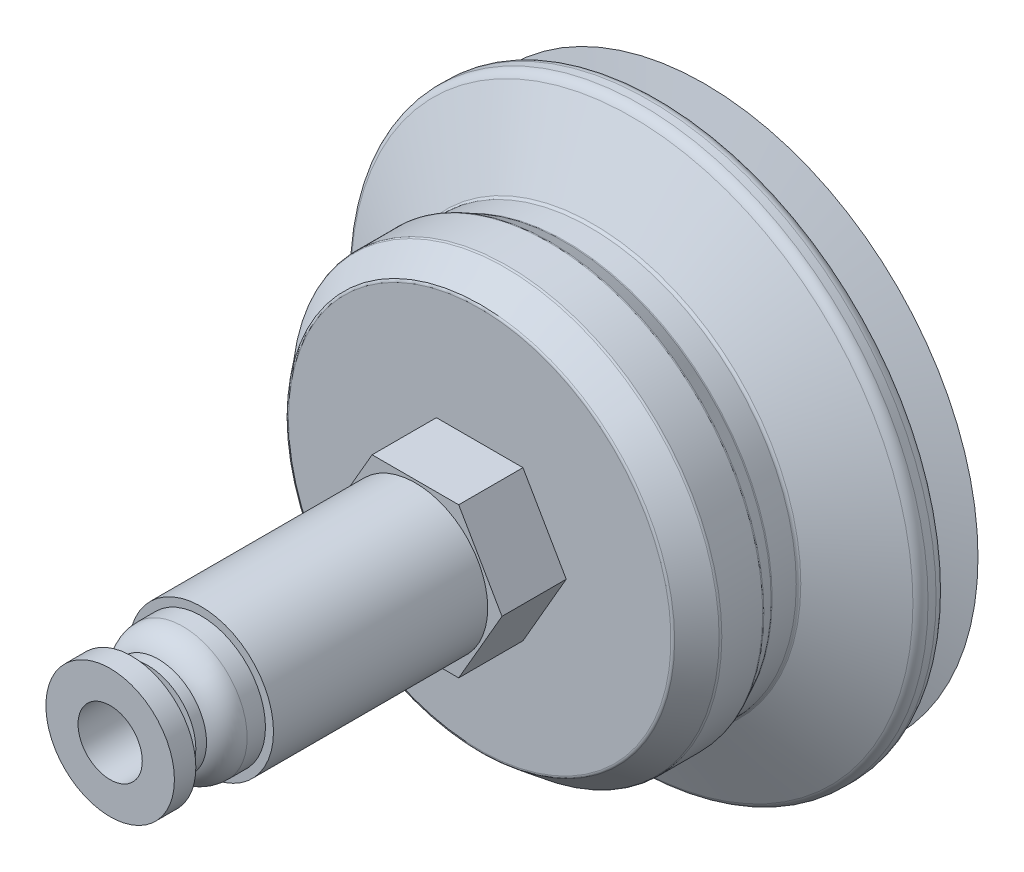
from build123d import *

# Parameters (mm, degrees)
EXTRUDE_1_DEPTH     = 6
SKETCH_2_R          = 6.75
EXTRUDE_2_DEPTH     = 20
SKETCH_3_R          = 6
EXTRUDE_3_DEPTH     = 4
SKETCH_4_R          = 4.5
EXTRUDE_4_DEPTH     = 1
SKETCH_5_R          = 3.5
EXTRUDE_5_DEPTH     = 1.5
SKETCH_6_R          = 6
EXTRUDE_6_DEPTH     = 2
SKETCH_7_R          = 18
EXTRUDE_8_DEPTH     = 2.5
EXTRUDE_8_DRAFT     = -38.7
SKETCH_9_R          = 20.002877676
EXTRUDE_9_DEPTH     = 4
SKETCH_10_R         = 20.002877676
EXTRUDE_10_DEPTH    = 1.5
EXTRUDE_10_TAPER    = 27
SKETCH_11_R         = 19.238589502
EXTRUDE_11_DEPTH    = 2.5
SKETCH_12_R         = 19.238589502
EXTRUDE_12_DEPTH    = 4
EXTRUDE_12_DRAFT    = -62
SKETCH_13_R         = 26.761495364
EXTRUDE_13_DEPTH    = 2
SKETCH_14_R         = 26.761495364
EXTRUDE_14_DEPTH    = 3
EXTRUDE_14_TAPER    = 66.1
SKETCH_15_R         = 19.991610575
EXTRUDE_15_DEPTH    = 1.5
EXTRUDE_15_DRAFT    = -74.83
FILLET_1_R          = 1
FILLET_2_R          = 0.3
FILLET_3_R          = 0.3
SKETCH_16_R         = 1.5
CUT_EXTRUDE_2_DEPTH = 68.175928115
SKETCH_17_R         = 3
CUT_EXTRUDE_3_DEPTH = 8
FILLET_4_R          = 2.5
SKETCH_18_R         = 16.5
CUT_EXTRUDE_4_DEPTH = 6
SKETCH_19_R         = 10
CUT_EXTRUDE_5_DEPTH = 5
EXTRUDE_START       = 2
SKETCH_20_R         = 5.75
SKETCH_20_R_2       = 1.5
EXTRUDE_16_DEPTH    = 2
SKETCH_21_R         = 23.523974929
CUT_EXTRUDE_6_DEPTH = 3
CUT_EXTRUDE_6_DRAFT = -70


with BuildPart() as part:
    # 草图1 → 凸台-拉伸1 (new body)
    with BuildSketch(Plane.XY):
        Polygon((8.082903769, 0), (4.041451884, 7), (-4.041451884, 7), (-8.082903769, 0), (-4.041451884, -7), (4.041451884, -7), align=None)
    extrude(amount=EXTRUDE_1_DEPTH)

    # 草图2 → 凸台-拉伸2 (add)
    with BuildSketch(Plane.XY.offset(6)):
        Circle(SKETCH_2_R)
    extrude(amount=EXTRUDE_2_DEPTH)

    # 草图3 → 凸台-拉伸3 (add)
    with BuildSketch(Plane.XY.offset(26)):
        Circle(SKETCH_3_R)
    extrude(amount=EXTRUDE_3_DEPTH)

    # 草图4 → 凸台-拉伸4 (add)
    with BuildSketch(Plane.XY.offset(30)):
        Circle(SKETCH_4_R)
    extrude(amount=EXTRUDE_4_DEPTH)

    # 草图5 → 凸台-拉伸5 (add)
    with BuildSketch(Plane.XY.offset(31)):
        Circle(SKETCH_5_R)
    extrude(amount=EXTRUDE_5_DEPTH)

    # 草图6 → 凸台-拉伸6 (add)
    with BuildSketch(Plane.XY.offset(32.5)):
        Circle(SKETCH_6_R)
    extrude(amount=EXTRUDE_6_DEPTH)


with BuildPart() as extrude_8_tool:
    # 草图7 → 凸台-拉伸8 (with draft: the straight prism first)
    with BuildSketch(Plane(origin=(0, 0, 0), x_dir=(-1, 0, 0), z_dir=(0, 0, -1))):
        Circle(SKETCH_7_R)
    extrude(amount=EXTRUDE_8_DEPTH)
    # 凸台-拉伸8: the draft: its side faces are tilted about the plane it starts from
    extrude_8_sides = [extrude_8_tool.faces().sort_by_distance(p)[0] for p in [
        (18, 0, -1.25),
    ]]
    draft(extrude_8_sides, Plane(origin=(0, 0, 0), x_dir=(-1, 0, 0), z_dir=(0, 0, -1)), EXTRUDE_8_DRAFT)


with BuildPart() as part_1:
    add(part.part)

    # 凸台-拉伸8: add extrude_8_tool
    add(extrude_8_tool.part)

    # 草图9 → 凸台-拉伸9 (add)
    with BuildSketch(Plane(origin=(0, 0, -2.5), x_dir=(-1, 0, 0), z_dir=(0, 0, -1))):
        Circle(SKETCH_9_R)
    extrude(amount=EXTRUDE_9_DEPTH)

    # 草图10 → 凸台-拉伸10 (add)
    with BuildSketch(Plane(origin=(0, 0, -6.5), x_dir=(-1, 0, 0), z_dir=(0, 0, -1))):
        Circle(SKETCH_10_R)
    extrude(amount=EXTRUDE_10_DEPTH, taper=EXTRUDE_10_TAPER)

    # 草图11 → 凸台-拉伸11 (add)
    with BuildSketch(Plane(origin=(0, 0, -8), x_dir=(-1, 0, 0), z_dir=(0, 0, -1))):
        Circle(SKETCH_11_R)
    extrude(amount=EXTRUDE_11_DEPTH)


with BuildPart() as extrude_12_tool:
    # 草图12 → 凸台-拉伸12 (with draft: the straight prism first)
    with BuildSketch(Plane(origin=(0, 0, -10.5), x_dir=(-1, 0, 0), z_dir=(0, 0, -1))):
        Circle(SKETCH_12_R)
    extrude(amount=EXTRUDE_12_DEPTH)
    # 凸台-拉伸12: the draft: its side faces are tilted about the plane it starts from
    extrude_12_sides = [extrude_12_tool.faces().sort_by_distance(p)[0] for p in [
        (19.238589502, 0, -12.5),
    ]]
    draft(extrude_12_sides, Plane(origin=(0, 0, -10.5), x_dir=(-1, 0, 0), z_dir=(0, 0, -1)), EXTRUDE_12_DRAFT)


with BuildPart() as part_2:
    add(part_1.part)

    # 凸台-拉伸12: add extrude_12_tool
    add(extrude_12_tool.part)

    # 草图13 → 凸台-拉伸13 (add)
    with BuildSketch(Plane(origin=(0, 0, -14.5), x_dir=(-1, 0, 0), z_dir=(0, 0, -1))):
        Circle(SKETCH_13_R)
    extrude(amount=EXTRUDE_13_DEPTH)

    # 草图14 → 凸台-拉伸14 (add)
    with BuildSketch(Plane(origin=(0, 0, -16.5), x_dir=(-1, 0, 0), z_dir=(0, 0, -1))):
        Circle(SKETCH_14_R)
    extrude(amount=EXTRUDE_14_DEPTH, taper=EXTRUDE_14_TAPER)


with BuildPart() as extrude_15_tool:
    # 草图15 → 凸台-拉伸15 (with draft: the straight prism first)
    with BuildSketch(Plane(origin=(0, 0, -19.5), x_dir=(-1, 0, 0), z_dir=(0, 0, -1))):
        Circle(SKETCH_15_R)
    extrude(amount=EXTRUDE_15_DEPTH)
    # 凸台-拉伸15: the draft: its side faces are tilted about the plane it starts from
    extrude_15_sides = [extrude_15_tool.faces().sort_by_distance(p)[0] for p in [
        (19.991610575, 0, -20.25),
    ]]
    draft(extrude_15_sides, Plane(origin=(0, 0, -19.5), x_dir=(-1, 0, 0), z_dir=(0, 0, -1)), EXTRUDE_15_DRAFT)


with BuildPart() as part_3:
    add(part_2.part)

    # 凸台-拉伸15: add extrude_15_tool
    add(extrude_15_tool.part)

    # 圆角1
    fillet_1_edges = [part_3.edges().sort_by_distance(p)[0] for p in [
        (26.761495364, 0, -14.5),
        (26.761495364, 0, -16.5),
    ]]
    fillet(fillet_1_edges, radius=FILLET_1_R)

    # 圆角2
    fillet_2_edges = [part_3.edges().sort_by_distance(p)[0] for p in [
        (19.991610575, 0, -19.5),
    ]]
    fillet(fillet_2_edges, radius=FILLET_2_R)

    # 圆角3
    fillet_3_edges = [part_3.edges().sort_by_distance(p)[0] for p in [
        (18, 0, 0),
        (20.002877676, 0, -2.5),
        (20.002877676, 0, -6.5),
        (19.238589502, 0, -8),
        (19.238589502, 0, -10.5),
    ]]
    fillet(fillet_3_edges, radius=FILLET_3_R)

    # 草图16 → 切除-拉伸2 (cut, through all)
    with BuildSketch(Plane(origin=(0, 0, -21), x_dir=(-1, 0, 0), z_dir=(0, 0, -1))):
        Circle(SKETCH_16_R)
    extrude(amount=-CUT_EXTRUDE_2_DEPTH, mode=Mode.SUBTRACT)

    # 草图17 → 切除-拉伸3 (cut)
    with BuildSketch(Plane.XY.offset(34.5)):
        Circle(SKETCH_17_R)
    extrude(amount=-CUT_EXTRUDE_3_DEPTH, mode=Mode.SUBTRACT)

    # 圆角4
    # the kernel refuses this fillet: 2.5 mm, written as the material it takes off along each edge
    with BuildSketch(Plane(origin=(0, 0, 30), x_dir=(1, 0, 0), z_dir=(0, -1, 0))) as fillet_4_piece_1:
        with BuildLine():
            CenterArc((3.5, -2.291287847), FILLET_4_R, 0, 66.421821522)
            Line((4.5, 0), (4.52, 0.045825757))
            ThreePointArc((4.52, 0.045825757), (5.25, 0.05), (6, 0.05))
            Line((6, 0.05), (6.05, 0))
            Line((6.05, 0), (6.05, -2.291287847))
            Line((6.05, -2.291287847), (6, -2.291287847))
        make_face()
    revolve(axis=Axis((0, 0, 30), (0, 0, 1)), mode=Mode.SUBTRACT)

    # 草图18 → 切除-拉伸4 (cut)
    with BuildSketch(Plane(origin=(0, 0, -21), x_dir=(-1, 0, 0), z_dir=(0, 0, -1))):
        Circle(SKETCH_18_R)
    extrude(amount=-CUT_EXTRUDE_4_DEPTH, mode=Mode.SUBTRACT)

    # 草图19 → 切除-拉伸5 (cut)
    with BuildSketch(Plane(origin=(0, 0, -15), x_dir=(-1, 0, 0), z_dir=(0, 0, -1))):
        Circle(SKETCH_19_R)
    extrude(amount=-CUT_EXTRUDE_5_DEPTH, mode=Mode.SUBTRACT)

    # 草图20 → 凸台-拉伸16 (add)
    with BuildSketch(Plane(origin=(0, 0, -10), x_dir=(-1, 0, 0), z_dir=(0, 0, -1)).offset(EXTRUDE_START)):
        Circle(SKETCH_20_R)
        Circle(SKETCH_20_R_2, mode=Mode.SUBTRACT)
    extrude(amount=-EXTRUDE_16_DEPTH)


with BuildPart() as cut_extrude_6_tool:
    # 草图21 → 切除-拉伸6 (with draft: the straight prism first)
    with BuildSketch(Plane(origin=(0, 0, -21), x_dir=(-1, 0, 0), z_dir=(0, 0, -1))):
        Circle(SKETCH_21_R)
    extrude(amount=-CUT_EXTRUDE_6_DEPTH)
    # 切除-拉伸6: the draft: its side faces are tilted about the plane it starts from
    cut_extrude_6_sides = [cut_extrude_6_tool.faces().sort_by_distance(p)[0] for p in [
        (23.523974929, 0, -19.5),
    ]]
    draft(cut_extrude_6_sides, Plane(origin=(0, 0, -21), x_dir=(-1, 0, 0), z_dir=(0, 0, -1)), CUT_EXTRUDE_6_DRAFT)


with BuildPart() as part_4:
    add(part_3.part)

    # 切除-拉伸6: cut by cut_extrude_6_tool
    add(cut_extrude_6_tool.part, mode=Mode.SUBTRACT)


solid = part_4.part
